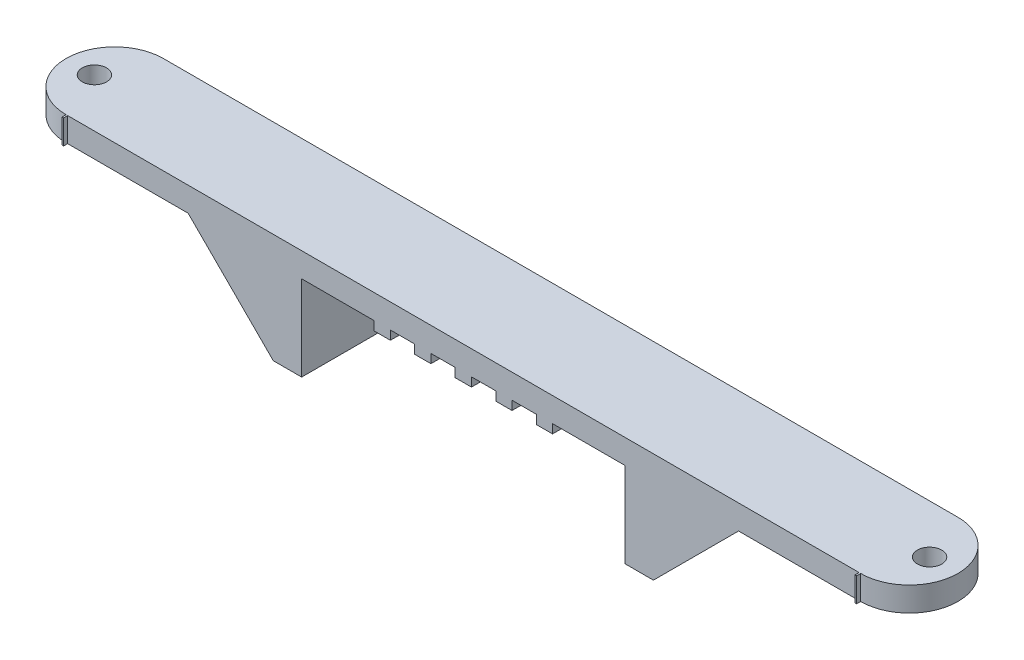
from build123d import *

# Parameters (mm, degrees)
SKETCH1_R                 = 1.5
BOSS_EXTRUDE1_DEPTH       = 3
SKETCH4_W                 = 3.5
SKETCH4_H                 = 12
BOSS_EXTRUDE3_DEPTH       = 10.5
SKETCH5_W                 = 2
SKETCH5_H                 = 12
BOSS_EXTRUDE4_DEPTH       = 1.1
SKETCH6_W                 = 0.2
SKETCH6_H                 = 3
BOSS_EXTRUDE5_DEPTH       = 0.5
CHAMFER1_SIZE             = 10.5
F_3_0MM_DOWEL_HOLE1_D     = 3
F_3_0MM_DOWEL_HOLE1_DEPTH = 13.5


with BuildPart() as part:
    # Sketch1 → Boss-Extrude1 (new body)
    with BuildSketch(Plane(origin=(0, 0, 0), x_dir=(1, 0, 0), z_dir=(0, 1, 0))):
        with BuildLine():
            Line((-49, 6), (49, 6))
            ThreePointArc((49, 6), (55, 0), (49, -6))
            Line((49, -6), (-49, -6))
            ThreePointArc((-49, -6), (-55, 0), (-49, 6))
        make_face()
        with Locations(Location((-51.5, 0, 0), (0, 0, 270))):
            Circle(SKETCH1_R, mode=Mode.SUBTRACT)
        with Locations(Location((51.5, 0, 0), (0, 0, 270))):
            Circle(SKETCH1_R, mode=Mode.SUBTRACT)
    extrude(amount=BOSS_EXTRUDE1_DEPTH)

    # Sketch4 → Boss-Extrude3 (add)
    with BuildSketch(Plane.XZ):
        with Locations((-21.690023983, 0)):
            Rectangle(SKETCH4_W, SKETCH4_H)
        with Locations((21.690023983, 0)):
            Rectangle(SKETCH4_W, SKETCH4_H)
    extrude(amount=BOSS_EXTRUDE3_DEPTH)

    # Sketch5 → Boss-Extrude4 (add)
    with BuildSketch(Plane.XZ):
        with Locations((5, 0)):
            Rectangle(SKETCH5_W, SKETCH5_H)
        Rectangle(SKETCH5_W, SKETCH5_H)
        with Locations((10, 0)):
            Rectangle(SKETCH5_W, SKETCH5_H)
        with Locations((-5, 0)):
            Rectangle(SKETCH5_W, SKETCH5_H)
        with Locations((-10, 0)):
            Rectangle(SKETCH5_W, SKETCH5_H)
    extrude(amount=BOSS_EXTRUDE4_DEPTH)

    # Sketch6 → Boss-Extrude5 (add)
    with BuildSketch(Plane.XY.offset(6)):
        with Locations((48.9, 1.5)):
            Rectangle(SKETCH6_W, SKETCH6_H)
        with Locations((-48.9, 1.5)):
            Rectangle(SKETCH6_W, SKETCH6_H)
    extrude(amount=BOSS_EXTRUDE5_DEPTH)

    # Chamfer1
    chamfer1_edges = [part.edges().sort_by_distance(p)[0] for p in [
        (23.440023983, 0, 0),
        (-23.440023983, 0, 0),
    ]]
    chamfer(chamfer1_edges, length=CHAMFER1_SIZE - 0.0001)  # a hair under: the kernel refuses the full size

    # Ø3.0mm Dowel Hole1
    with Locations(Plane(origin=(0, 3, 0), x_dir=(1, 0, 0), z_dir=(0, 1, 0))):
        with Locations((-51.5, 0), (51.5, 0)):
            Hole(F_3_0MM_DOWEL_HOLE1_D / 2, depth=F_3_0MM_DOWEL_HOLE1_DEPTH)


solid = part.part
